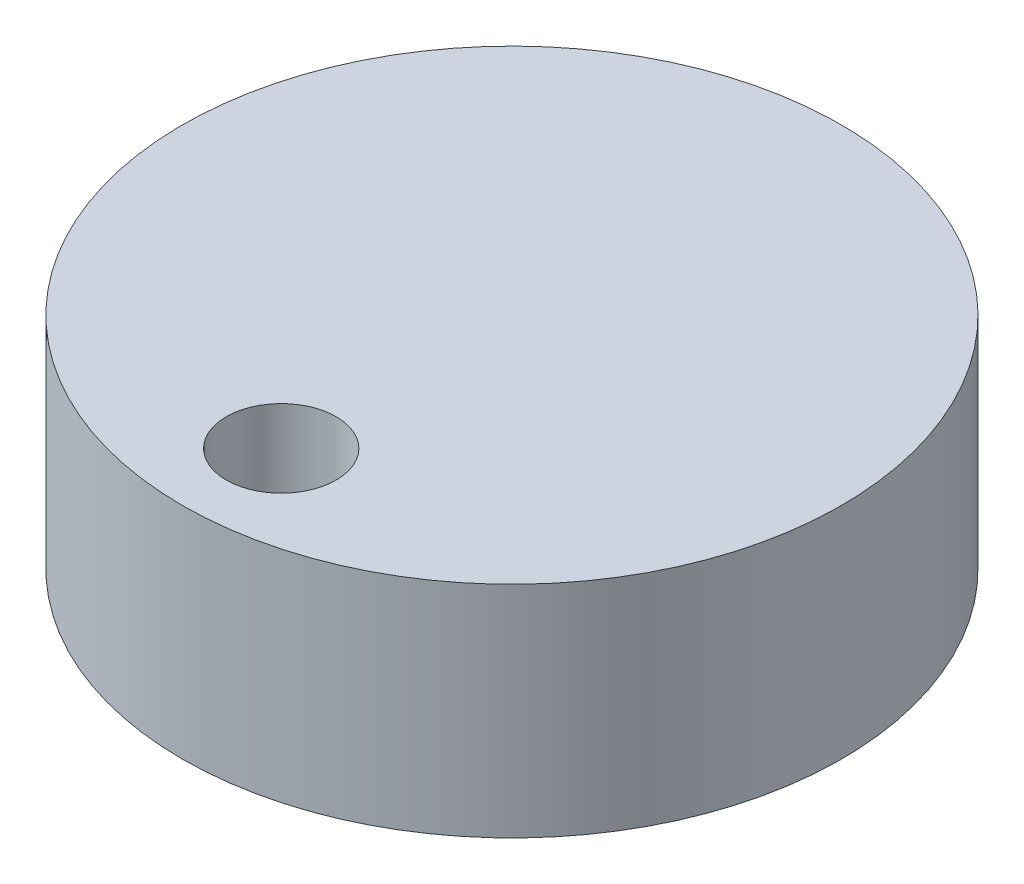
from build123d import *

# Parameters (mm, degrees)
BOSS_EXTRUDE1_DEPTH      = 6.35
BOSS_EXTRUDE1_DEPTH_BACK = 6.35
SKETCH1_R                = 19.05
SKETCH1_R_2              = 3.175


with BuildPart() as part:
    # Sketch1 → Boss-Extrude1 (new, two sides: drawn at the far end of the back side and taken through both)
    with BuildSketch(Plane(origin=(0, 0, 0), x_dir=(1, 0, 0), z_dir=(0, 1, 0)).offset(-BOSS_EXTRUDE1_DEPTH_BACK)):
        with Locations((0, 13.335)):
            Circle(SKETCH1_R)
        Circle(SKETCH1_R_2, mode=Mode.SUBTRACT)
    extrude(amount=BOSS_EXTRUDE1_DEPTH + BOSS_EXTRUDE1_DEPTH_BACK)


solid = part.part
